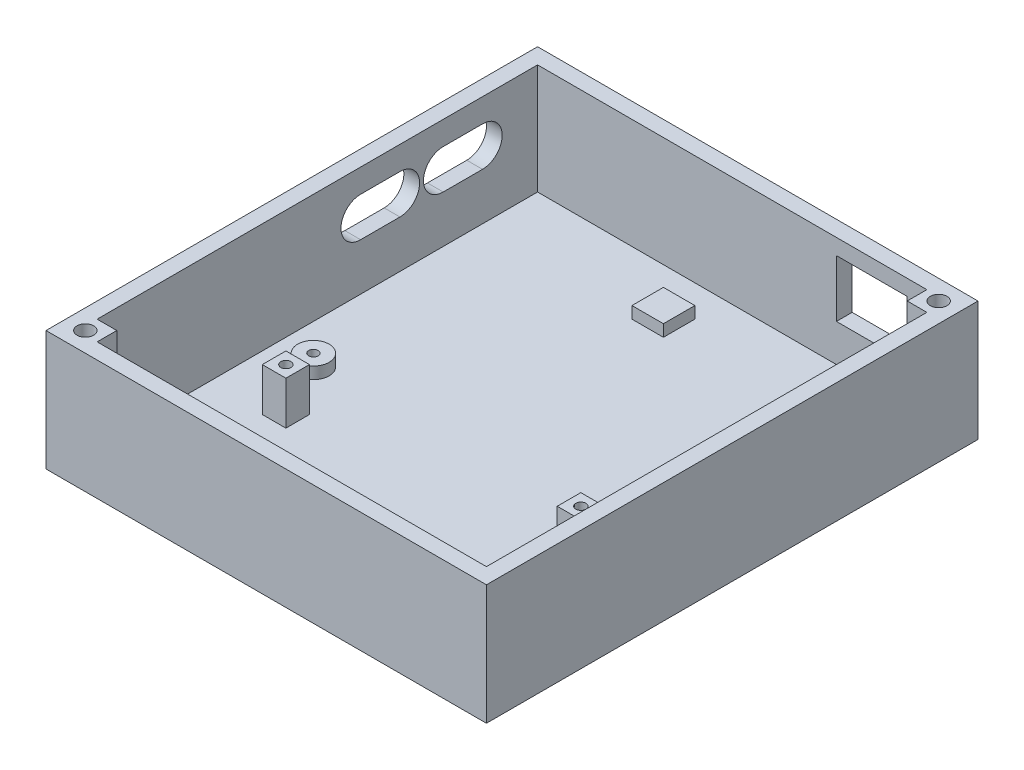
from build123d import *

# Parameters (mm, degrees)
SKETCH1_W           = 112
SKETCH1_H           = 125
BOSS_EXTRUDE1_DEPTH = 2.5
SKETCH2_W           = 112
SKETCH2_H           = 125
SKETCH2_R           = 2.1
BOSS_EXTRUDE2_DEPTH = 10
SKETCH3_W           = 6
SKETCH3_H           = 6
SKETCH3_R           = 1.3
BOSS_EXTRUDE3_DEPTH = 11
SKETCH5_R           = 4
SKETCH5_R_2         = 1.2
SKETCH5_W           = 8
SKETCH5_H           = 8
BOSS_EXTRUDE4_DEPTH = 3
SKETCH6_W           = 6
SKETCH6_H           = 6
SKETCH6_R           = 1.3
BOSS_EXTRUDE5_DEPTH = 6.3
SKETCH7_W           = 112
SKETCH7_H           = 125
SKETCH7_R           = 2.1
BOSS_EXTRUDE6_DEPTH = 18
CUT_EXTRUDE1_REACH  = 133.835
CUT_EXTRUDE2_REACH  = 142.326
SKETCH10_W          = 18
SKETCH10_H          = 14.5


with BuildPart() as part:
    # Sketch1 → Boss-Extrude1 (new body)
    with BuildSketch(Plane(origin=(0, 0, 0), x_dir=(1, 0, 0), z_dir=(0, 1, 0))):
        Rectangle(SKETCH1_W, SKETCH1_H)
    extrude(amount=BOSS_EXTRUDE1_DEPTH)

    # Sketch2 → Boss-Extrude2 (add)
    with BuildSketch(Plane(origin=(0, 2.5, 0), x_dir=(1, 0, 0), z_dir=(0, 1, 0))):
        Rectangle(SKETCH2_W, SKETCH2_H)
        Polygon((47, 53.5), (52, 53.5), (52, -58.5), (-47, -58.5), (-47, -53.5), (-52, -53.5), (-52, 58.5), (47, 58.5), align=None, mode=Mode.SUBTRACT)
        with Locations((51, 57.5)):
            Circle(SKETCH2_R, mode=Mode.SUBTRACT)
        with Locations((-51, -57.5)):
            Circle(SKETCH2_R, mode=Mode.SUBTRACT)
    extrude(amount=BOSS_EXTRUDE2_DEPTH)

    # Sketch3 → Boss-Extrude3 (add)
    # profile 1 of 4: a face of its own
    with BuildSketch(Plane(origin=(0, 2.5, 0), x_dir=(1, 0, 0), z_dir=(0, 1, 0))):
        with Locations((-35, -22.5)):
            Rectangle(SKETCH3_W, SKETCH3_H)
        with Locations((-35, -22.5)):
            Circle(SKETCH3_R, mode=Mode.SUBTRACT)
    # profile 2 of 4: a face of its own
    with BuildSketch(Plane(origin=(0, 2.5, 0), x_dir=(1, 0, 0), z_dir=(0, 1, 0))):
        with Locations((40, -22.5)):
            Rectangle(SKETCH3_W, SKETCH3_H)
        with Locations((40, -22.5)):
            Circle(SKETCH3_R, mode=Mode.SUBTRACT)
    # profile 3 of 4: a face of its own
    with BuildSketch(Plane(origin=(0, 2.5, 0), x_dir=(1, 0, 0), z_dir=(0, 1, 0))):
        with Locations((-35, -53.5)):
            Rectangle(SKETCH3_W, SKETCH3_H)
        with Locations((-35, -53.5)):
            Circle(SKETCH3_R, mode=Mode.SUBTRACT)
    # profile 4 of 4: a face of its own
    with BuildSketch(Plane(origin=(0, 2.5, 0), x_dir=(1, 0, 0), z_dir=(0, 1, 0))):
        with Locations((40, -53.5)):
            Rectangle(SKETCH3_W, SKETCH3_H)
        with Locations((40, -53.5)):
            Circle(SKETCH3_R, mode=Mode.SUBTRACT)
    extrude(amount=BOSS_EXTRUDE3_DEPTH)

    # Sketch5 → Boss-Extrude4 (add)
    # profile 1 of 3: a face of its own
    with BuildSketch(Plane(origin=(0, 2.5, 0), x_dir=(1, 0, 0), z_dir=(0, 1, 0))):
        with Locations((-42, -8.5)):
            Circle(SKETCH5_R)
        with Locations((-42, -8.5)):
            Circle(SKETCH5_R_2, mode=Mode.SUBTRACT)
    # profile 2 of 3: a face of its own
    with BuildSketch(Plane(origin=(0, 2.5, 0), x_dir=(1, 0, 0), z_dir=(0, 1, 0))):
        with Locations((38, -8.5)):
            Circle(SKETCH5_R)
        with Locations((38, -8.5)):
            Circle(SKETCH5_R_2, mode=Mode.SUBTRACT)
    # profile 3 of 3: a face of its own
    with BuildSketch(Plane(origin=(0, 2.5, 0), x_dir=(1, 0, 0), z_dir=(0, 1, 0))):
        with Locations((-8, 46.5)):
            Rectangle(SKETCH5_W, SKETCH5_H)
    extrude(amount=BOSS_EXTRUDE4_DEPTH)

    # Sketch6 → Boss-Extrude5 (add)
    # profile 1 of 3: a face of its own
    with BuildSketch(Plane(origin=(0, 13.5, 0), x_dir=(1, 0, 0), z_dir=(0, 1, 0))):
        with Locations((-35, -53.5)):
            Rectangle(SKETCH6_W, SKETCH6_H)
        with Locations((-35, -53.5)):
            Circle(SKETCH6_R, mode=Mode.SUBTRACT)
    # profile 2 of 3: a face of its own
    with BuildSketch(Plane(origin=(0, 13.5, 0), x_dir=(1, 0, 0), z_dir=(0, 1, 0))):
        with Locations((40, -22.5)):
            Rectangle(SKETCH6_W, SKETCH6_H)
        with Locations((40, -22.5)):
            Circle(SKETCH6_R, mode=Mode.SUBTRACT)
    # profile 3 of 3: a face of its own
    with BuildSketch(Plane(origin=(0, 13.5, 0), x_dir=(1, 0, 0), z_dir=(0, 1, 0))):
        with Locations((40, -53.5)):
            Rectangle(SKETCH6_W, SKETCH6_H)
        with Locations((40, -53.5)):
            Circle(SKETCH6_R, mode=Mode.SUBTRACT)
    extrude(amount=BOSS_EXTRUDE5_DEPTH)

    # Sketch7 → Boss-Extrude6 (add)
    with BuildSketch(Plane(origin=(0, 12.5, 0), x_dir=(1, 0, 0), z_dir=(0, 1, 0))):
        Rectangle(SKETCH7_W, SKETCH7_H)
        with Locations((-51, -57.5)):
            Circle(SKETCH7_R, mode=Mode.SUBTRACT)
        Polygon((47, 58.5), (47, 53.5), (52, 53.5), (52, -58.5), (-47, -58.5), (-47, -53.5), (-52, -53.5), (-52, 58.5), align=None, mode=Mode.SUBTRACT)
        with Locations((51, 57.5)):
            Circle(SKETCH7_R, mode=Mode.SUBTRACT)
    extrude(amount=BOSS_EXTRUDE6_DEPTH)

    # Sketch9 → Cut-Extrude1 (cut, up to next)
    with BuildSketch(Plane.ZY.offset(56), mode=Mode.PRIVATE) as cut_extrude1_sk1:
        with BuildLine():
            Line((-44.5, 24.5), (-34.5, 24.5))
            ThreePointArc((-34.5, 24.5), (-29.5, 19.5), (-34.5, 14.5))
            Line((-34.5, 14.5), (-44.5, 14.5))
            ThreePointArc((-44.5, 14.5), (-49.5, 19.5), (-44.5, 24.5))
        make_face()
    cut_extrude1_tool1 = extrude(cut_extrude1_sk1.sketch, amount=-CUT_EXTRUDE1_REACH, mode=Mode.PRIVATE) & part.part
    # Sketch9 → Cut-Extrude1 (cut, up to next)
    with BuildSketch(Plane.ZY.offset(56), mode=Mode.PRIVATE) as cut_extrude1_sk2:
        with BuildLine():
            Line((-23.5, 24.5), (-13.5, 24.5))
            ThreePointArc((-13.5, 24.5), (-8.5, 19.5), (-13.5, 14.5))
            Line((-13.5, 14.5), (-23.5, 14.5))
            ThreePointArc((-23.5, 14.5), (-28.5, 19.5), (-23.5, 24.5))
        make_face()
    cut_extrude1_tool2 = extrude(cut_extrude1_sk2.sketch, amount=-CUT_EXTRUDE1_REACH, mode=Mode.PRIVATE) & part.part
    add(cut_extrude1_tool1.solids().sort_by_distance((-56, 19.5, -39.5))[0], mode=Mode.SUBTRACT)
    add(cut_extrude1_tool2.solids().sort_by_distance((-56, 19.5, -18.5))[0], mode=Mode.SUBTRACT)

    # Sketch10 → Cut-Extrude2 (cut, up to next)
    with BuildSketch(Plane(origin=(0, 0, -62.5), x_dir=(-1, 0, 0), z_dir=(0, 0, -1)), mode=Mode.PRIVATE) as cut_extrude2_sk1:
        with Locations((-33, 19.25)):
            Rectangle(SKETCH10_W, SKETCH10_H)
    cut_extrude2_tool1 = extrude(cut_extrude2_sk1.sketch, amount=-CUT_EXTRUDE2_REACH, mode=Mode.PRIVATE) & part.part
    add(cut_extrude2_tool1.solids().sort_by_distance((33, 19.25, -62.5))[0], mode=Mode.SUBTRACT)


solid = part.part
